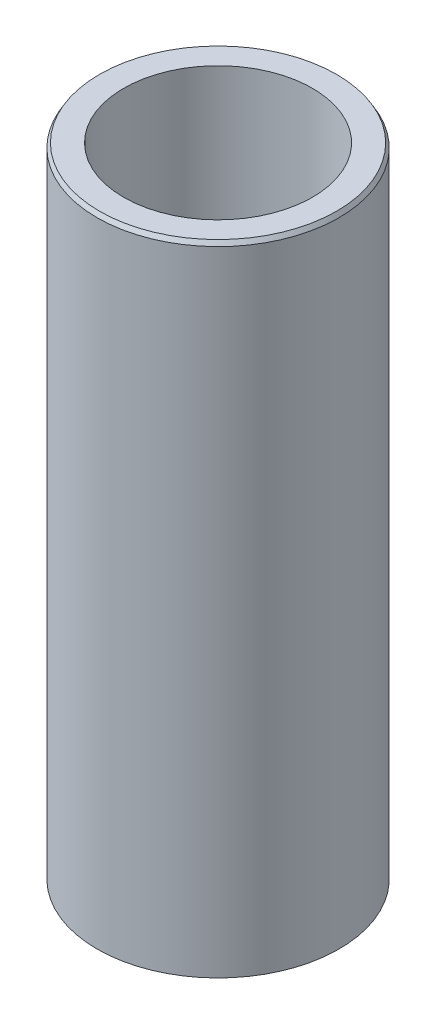
from build123d import *
from OCP.BRepFilletAPI import BRepFilletAPI_MakeChamfer

# Parameters (mm, degrees)
SKETCH1_R           = 30
BOSS_EXTRUDE1_DEPTH = 158.677275676
SKETCH2_R           = 23.402850791
CUT_EXTRUDE1_DEPTH  = 165.251264275
CHAMFER1_SIZE       = 1.074817816
CHAMFER1_SIZE2      = 0.620546356


with BuildPart() as part:
    # Sketch1 → Boss-Extrude1 (new body)
    with BuildSketch(Plane(origin=(0, 0, 0), x_dir=(1, 0, 0), z_dir=(0, 1, 0))):
        Circle(SKETCH1_R)
    extrude(amount=BOSS_EXTRUDE1_DEPTH)

    # Sketch2 → Cut-Extrude1 (cut, through all)
    with BuildSketch(Plane(origin=(0, 0, 0), x_dir=(1, 0, 0), z_dir=(0, 1, 0))):
        Circle(SKETCH2_R)
    extrude(amount=CUT_EXTRUDE1_DEPTH, mode=Mode.SUBTRACT)

    # Chamfer1: one chamfer whose edges measure the first distance from different faces: ONE call of the kernel's chamfer builder (chamfer() names one face for all edges)
    chamfer1_edges_1 = [part.edges().sort_by_distance(p)[0] for p in [
        (-30, 158.677275676, 0),
    ]]
    chamfer1_side_1 = [part.faces().sort_by_distance(p)[0] for p in [
        (-30, 79.338637838, 0),
    ]]
    chamfer1_edges_2 = [part.edges().sort_by_distance(p)[0] for p in [
        (-30, 0, 0),
    ]]
    chamfer1_side_2 = [part.faces().sort_by_distance(p)[0] for p in [
        (-29.151471863, 0, 0),
    ]]
    chamfer1 = BRepFilletAPI_MakeChamfer(part.part.solid().wrapped)
    for e in chamfer1_edges_1:
        chamfer1.Add(CHAMFER1_SIZE, CHAMFER1_SIZE2, e.wrapped, chamfer1_side_1[0].wrapped)  # the first distance lies on this face
    for e in chamfer1_edges_2:
        chamfer1.Add(CHAMFER1_SIZE, CHAMFER1_SIZE2, e.wrapped, chamfer1_side_2[0].wrapped)  # the first distance lies on this face
    add(Compound.cast(chamfer1.Shape()), mode=Mode.REPLACE)


solid = part.part
